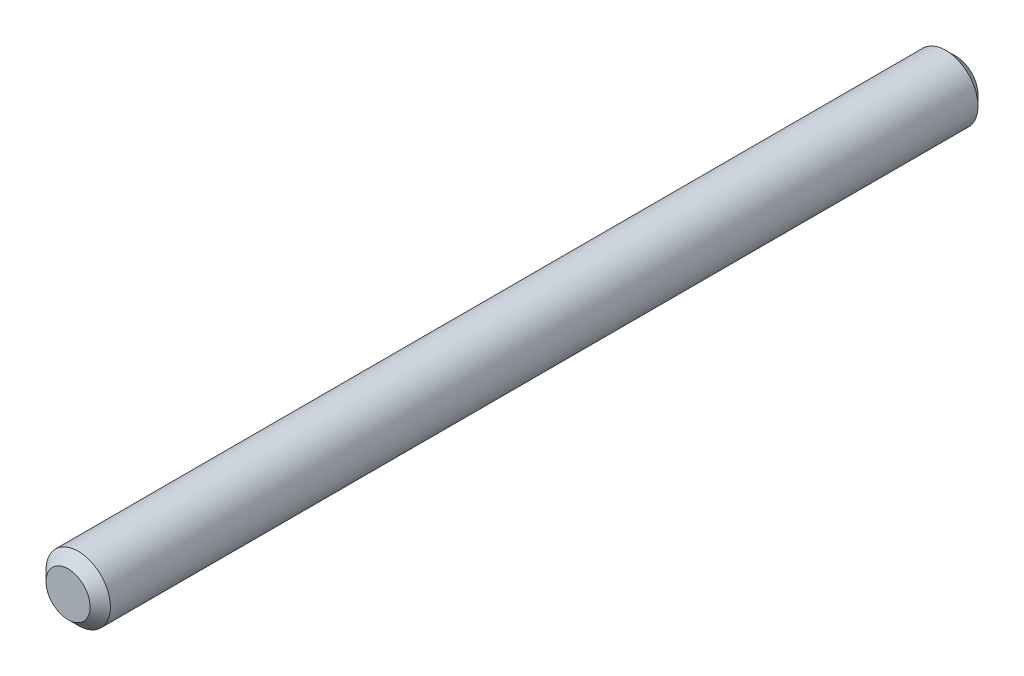
from build123d import *

# Parameters (mm, degrees)
SKETCH1_R           = 3.175
BOSS_EXTRUDE1_DEPTH = 87.5
CHAMFER1_SIZE       = 1


with BuildPart() as part:
    # Sketch1 → Boss-Extrude1 (new body)
    with BuildSketch(Plane.XY):
        Circle(SKETCH1_R)
    extrude(amount=-BOSS_EXTRUDE1_DEPTH)

    # Chamfer1
    chamfer1_edges = [part.edges().sort_by_distance(p)[0] for p in [
        (-3.175, 0, -87.5),
        (-3.175, 0, 0),
    ]]
    chamfer(chamfer1_edges, length=CHAMFER1_SIZE)


solid = part.part
